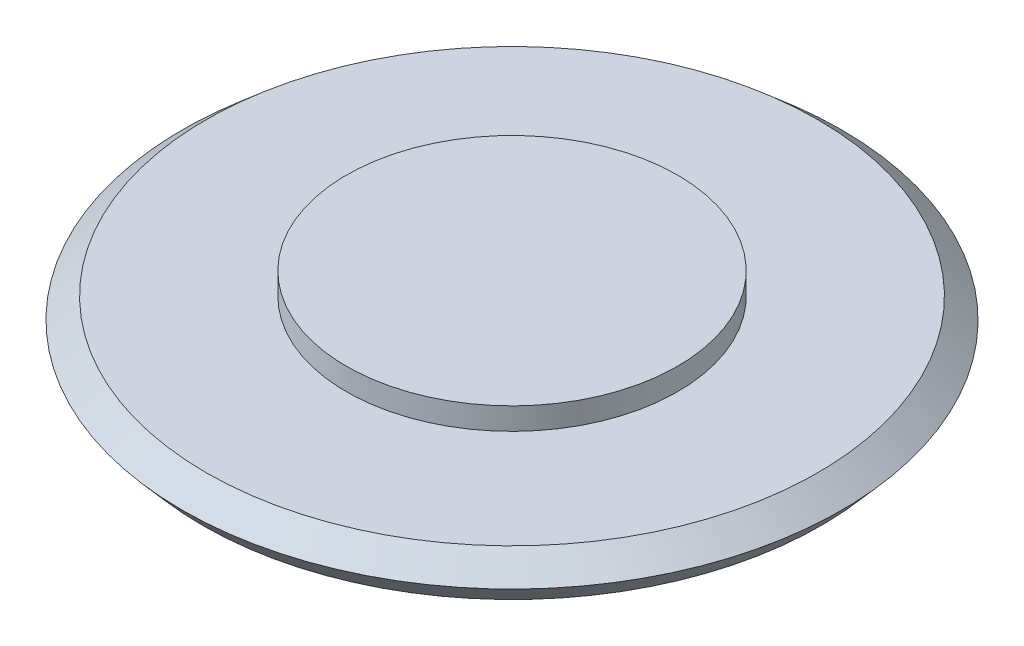
from build123d import *

# Parameters (mm, degrees)
BOSS_EXTRU_1_DEPTH      = 2
BOSS_EXTRU_1_DEPTH_BACK = 2
ESQUISSE1_R             = 30
CHANFREIN1_SIZE2        = 2.300736814
CHANFREIN1_SIZE         = 2
CHANFREIN2_SIZE         = 2.300736814
CHANFREIN2_SIZE_2       = 2
ESQUISSE2_R             = 15
BOSS_EXTRU_2_DEPTH      = 2


# Some blends are built 0.0001 mm under size
with BuildPart() as part:
    # Esquisse1 → Boss.-Extru.1 (new, two sides: drawn at the far end of the back side and taken through both)
    with BuildSketch(Plane(origin=(0, 0, 0), x_dir=(1, 0, 0), z_dir=(0, 1, 0)).offset(-BOSS_EXTRU_1_DEPTH_BACK)):
        with Locations(Location((0, 0, 0), (0, 0, 270))):
            Circle(ESQUISSE1_R)
    extrude(amount=BOSS_EXTRU_1_DEPTH + BOSS_EXTRU_1_DEPTH_BACK)

    # Chanfrein1
    chanfrein1_edges = [part.edges().sort_by_distance(p)[0] for p in [
        (0, 2, -30),
    ]]
    chanfrein1_side = [part.faces().sort_by_distance(p)[0] for p in [
        (0, 1.96, -30),
    ]]
    chamfer(chanfrein1_edges, length=CHANFREIN1_SIZE - 0.0001, length2=CHANFREIN1_SIZE2 - 0.0001, reference=chanfrein1_side[0])  # a hair under: the kernel refuses the full size

    # Chanfrein2
    # the kernel refuses this chamfer: 2.300736814, 2 mm, written as the material it takes off along each edge
    with BuildSketch(Plane(origin=(0, -2, 0), x_dir=(0, 0, 1), z_dir=(-1, 0, 0))) as chanfrein2_piece_1:
        Polygon((30, CHANFREIN2_SIZE), (30 - CHANFREIN2_SIZE_2, 0), (30, 0), align=None)
    revolve(axis=Axis((0, -2, 0), (0, 1, 0)), mode=Mode.SUBTRACT)

    # Esquisse2 → Boss.-Extru.2 (add)
    with BuildSketch(Plane.XZ.offset(2)):
        with Locations(Location((0, 0, 0), (0, 0, 270))):
            Circle(ESQUISSE2_R)
    boss_extru_2 = extrude(amount=BOSS_EXTRU_2_DEPTH)

    # Symétrie1: Boss.-Extru.2 across plane
    add(boss_extru_2.mirror(Plane.ZX))


solid = part.part
